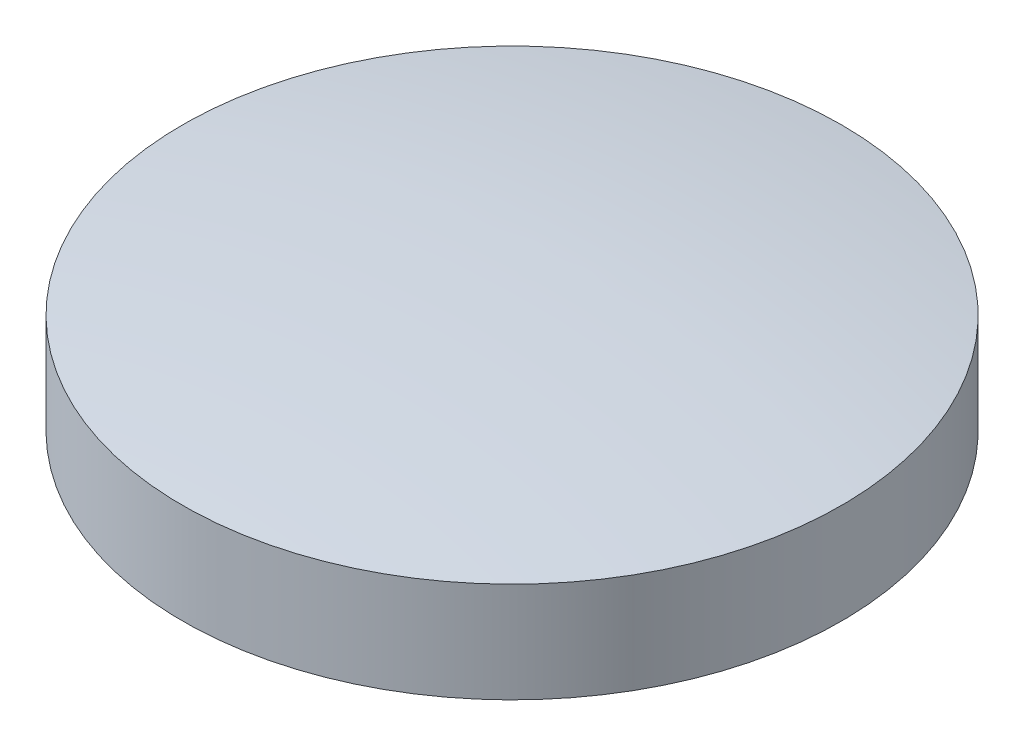
from build123d import *


with BuildPart() as part:
    # Skizze3 → Rotation1 (revolve)
    with BuildSketch(Plane(origin=(0, 0, 0), x_dir=(0, 0, -1), z_dir=(1, 0, 0))):
        with BuildLine():
            Line((0, 0), (25, 0))
            Line((25, 0), (25, 7.600527124))
            ThreePointArc((25, 7.600527124), (12.54011436, 9.103071716), (0, 9.604990299))
            Line((0, 9.604990299), (0, 0))
        make_face()
    revolve(axis=Axis((0, 0, 0), (0, 1, 0)))


solid = part.part
